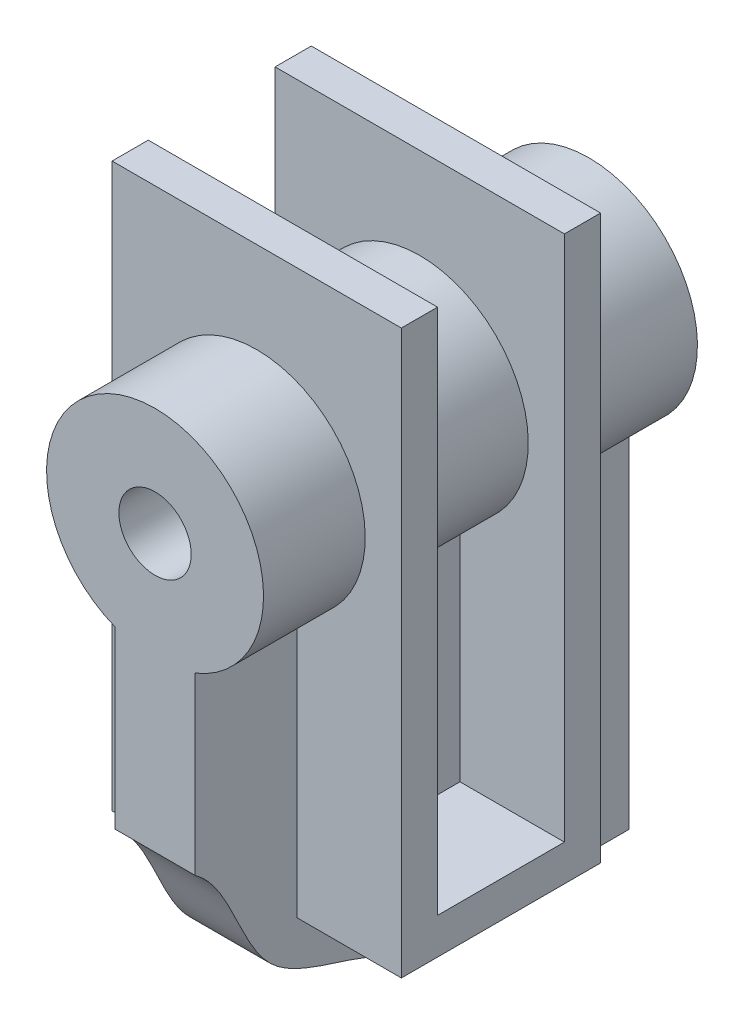
from build123d import *

# Parameters (mm, degrees)
EXTRUDE_5_DEPTH      = 30
EXTRUDE_5_DEPTH_BACK = 30
F_1_FR_R             = 5
EXTRUDE_6_DEPTH      = 20
EXTRUDE_6_DEPTH_BACK = 20
OTHER_START          = -5.557606452
OTHER_2_DEPTH        = 11.115212904


# Read off the part's stored shape, not the designer's step: Отступ2
with BuildPart() as part:
    # Эскиз1_fr → Бобышка-Вытянуть5 (new, two sides: drawn at the far end of the back side and taken through both)
    with BuildSketch(Plane.XY.offset(-EXTRUDE_5_DEPTH_BACK)):
        with BuildLine():
            Line((-5.557606452, -13.932444528), (-5.557606452, -62.642280008))
            Line((-5.557606452, -62.642280008), (5.557606452, -62.642280008))
            Line((5.557606452, -62.642280008), (5.557606452, -13.932444528))
            ThreePointArc((5.557606452, -13.932444528), (0, 15), (-5.557606452, -13.932444528))
        make_face()
        Circle(F_1_FR_R, mode=Mode.SUBTRACT)
    extrude(amount=EXTRUDE_5_DEPTH + EXTRUDE_5_DEPTH_BACK)

    # Отступ2 outline → Отступ2 (cut)
    with BuildSketch(Plane.YZ.offset(OTHER_START)):
        with BuildLine():
            add(Edge.make_bspline(
                [(-38.162129208, 30.000000201), (-38.350412386, 29.738589195), (-38.547242858, 29.484853366), (-38.752299072, 29.238505312), (-38.965259498, 28.99925828), (-39.185802485, 28.766826159), (-39.413606123, 28.540923423), (-39.64834813, 28.32126501), (-39.889705768, 28.107566173), (-40.137355811, 27.899542297), (-40.39097457, 27.696908743), (-40.650238001, 27.499380765), (-40.914821881, 27.306673579), (-41.184402075, 27.11850268), (-42.265778691, 26.393314992), (-43.113368902, 25.888872388), (-43.99315142, 25.414009108), (-44.896841535, 24.96146191), (-45.816149017, 24.523958449), (-46.742782565, 24.094220219), (-47.668453227, 23.664962906), (-48.584876381, 23.228895124), (-49.483771918, 22.778716473), (-50.356862203, 22.30711592), (-51.195867455, 21.806771428), (-51.992498133, 21.270351842), (-52.73844395, 20.690521946), (-53.511223517, 19.981130426), (-53.596170911, 19.901516083), (-53.680123568, 19.821092243), (-53.763413941, 19.739889031), (-53.844744398, 19.657606996), (-53.927459143, 19.575304006), (-54.004978314, 19.490233908), (-54.086963112, 19.407352212), (-54.162711198, 19.320126258), (-54.240798044, 19.234583034), (-54.316342943, 19.146873901), (-54.391361142, 19.058753339), (-54.465300564, 18.969694587), (-54.611255963, 18.789935065), (-54.683262919, 18.699224485), (-54.754314107, 18.607695324), (-54.824424506, 18.515359819), (-54.893609092, 18.422230207), (-54.961882842, 18.328318725), (-55.029260732, 18.233637612), (-55.095757741, 18.138199104), (-55.161388843, 18.042015438), (-55.226169019, 17.945098853), (-55.290113242, 17.847461585), (-55.353236491, 17.749115872), (-55.415553743, 17.650073952), (-55.600132437, 17.350896278), (-55.720020886, 17.148708437), (-55.836865309, 16.943882089), (-55.950785669, 16.736514739), (-56.061901911, 16.526703843), (-56.170333957, 16.31454681), (-56.276201707, 16.100141), (-56.379625042, 15.883583727), (-56.480723817, 15.664972254), (-56.579617872, 15.444403799), (-56.676427019, 15.221975529), (-56.771271052, 14.997784566), (-56.864269745, 14.771927983), (-57.138089051, 14.089652446), (-57.313732951, 13.628528404), (-57.48343208, 13.161907014), (-57.648143574, 12.690564713), (-57.808824172, 12.215278032), (-57.966430218, 11.736823601), (-58.121917654, 11.255978148), (-58.276242029, 10.773518498), (-58.430358494, 10.290221572), (-58.585221804, 9.806864391), (-58.741786314, 9.324224071), (-58.901005985, 8.843077827), (-59.063834379, 8.364202972), (-59.410471901, 7.378846098), (-59.594949774, 6.872811052), (-59.785830162, 6.371227061), (-59.984282319, 5.875048562), (-60.19147505, 5.385229705), (-60.408577178, 4.902724584), (-60.636757277, 4.428487146), (-60.877183329, 3.963470844), (-61.131022629, 3.508628159), (-61.399442059, 3.064910118), (-61.683608675, 2.633265954), (-61.984690452, 2.214643016), (-62.303856996, 1.809986968), (-62.642280061, 1.420242276)],
                knots=[0.165052435, 0.165052435, 0.165052435, 0.165052435, 0.165052435, 0.165052435, 0.165052435, 0.165052435, 0.165052435, 0.165052435, 0.165052435, 0.165052435, 0.165052435, 0.165052435, 0.165052435, 0.25, 0.25, 0.25, 0.25, 0.25, 0.25, 0.25, 0.25, 0.25, 0.25, 0.25, 0.25, 0.25, 0.5, 0.5, 0.5, 0.5, 0.5, 0.5, 0.5, 0.5, 0.5, 0.5, 0.5, 0.5, 0.5, 0.53125, 0.53125, 0.53125, 0.53125, 0.53125, 0.53125, 0.53125, 0.53125, 0.53125, 0.53125, 0.53125, 0.53125, 0.53125, 0.5625, 0.5625, 0.5625, 0.5625, 0.5625, 0.5625, 0.5625, 0.5625, 0.5625, 0.5625, 0.5625, 0.5625, 0.5625, 0.625, 0.625, 0.625, 0.625, 0.625, 0.625, 0.625, 0.625, 0.625, 0.625, 0.625, 0.625, 0.625, 0.75, 0.75, 0.75, 0.75, 0.75, 0.75, 0.75, 0.75, 0.75, 0.75, 0.75, 0.75, 0.75, 0.883854275, 0.883854275, 0.883854275, 0.883854275, 0.883854275, 0.883854275, 0.883854275, 0.883854275, 0.883854275, 0.883854275, 0.883854275, 0.883854275, 0.883854275, 0.883854275, 0.883854275], degree=14))
            Line((-38.162129208, 30.000000201), (-62.642280008, 30))
            Line((-62.642280008, 30), (-62.642280061, 1.420242276))
        make_face()
    extrude(amount=OTHER_2_DEPTH, mode=Mode.SUBTRACT)


with BuildPart() as body_2:
    # Эскиз3 → Бобышка-Вытянуть6 (new, two sides: drawn at the far end of the back side and taken through both)
    with BuildSketch(Plane(origin=(0, 0, 0), x_dir=(0, 0, -1), z_dir=(1, 0, 0)).offset(-EXTRUDE_6_DEPTH_BACK)):
        Polygon((-58.394498043, -50.25314581), (-85.938130262, -50.25314581), (-85.938130262, 27.580465306), (-80.938130262, 27.580465306), (-80.938130262, -45.25314581), (-63.394498043, -45.25314581), (-63.394498043, 27.580465306), (-58.394498043, 27.580465306), align=None)
    extrude(amount=EXTRUDE_6_DEPTH + EXTRUDE_6_DEPTH_BACK)


with BuildPart() as body_2_1:
    # Move Body 1: moved
    add(body_2.part.moved(Location((0, 0, -70))))


solid = Compound([part.part, body_2_1.part])
